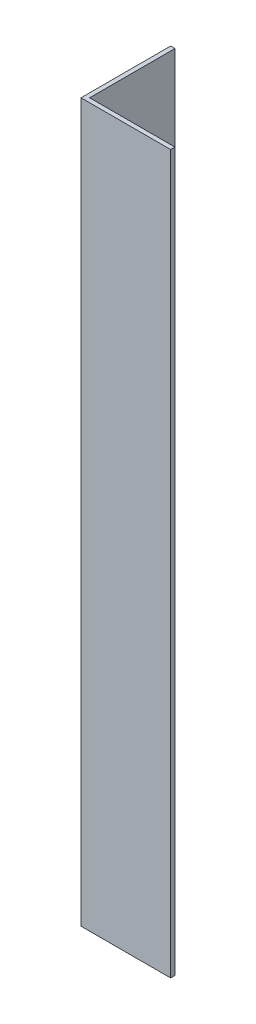
from build123d import *

# Parameters (mm, degrees)
BOSS_EXTRUDE1_DEPTH = 50.8


with BuildPart() as part:
    # Sketch1 → Boss-Extrude1 (new body)
    with BuildSketch(Plane(origin=(0, 0, 0), x_dir=(1, 0, 0), z_dir=(0, 1, 0))):
        Polygon((0, 0), (6.35, 0), (6.35, 0.3048), (0.3048, 0.3048), (0.3048, 6.35), (0, 6.35), align=None)
    extrude(amount=BOSS_EXTRUDE1_DEPTH)


solid = part.part
